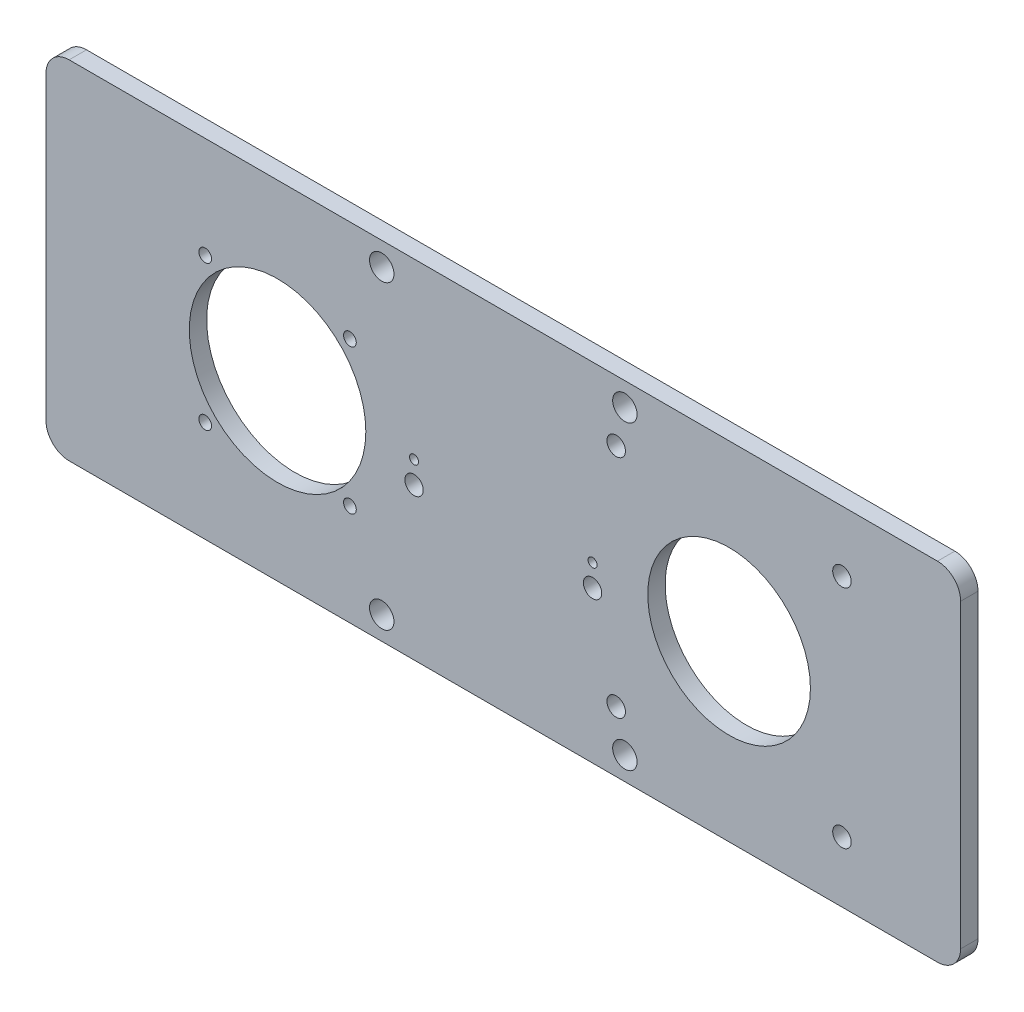
from build123d import *

# Parameters (mm, degrees)
SKETCH3_W             = 158
SKETCH3_H             = 60
SKETCH3_R             = 15.25
SKETCH3_R_2           = 14.05
BOSS_EXTRUDE2_DEPTH   = 3
FILLET1_R             = 4
EVK4_HOLES_D          = 2.2
FLIR_HOLES_D          = 3.2
VN_MOUNT_HOLES_D      = 3.175
VN_REF_HOLES_D        = 1.55
F_1_0MM_DOWEL_HOLE5_D = 4.22


with BuildPart() as part:
    # Sketch3 → Boss-Extrude2 (new body)
    with BuildSketch(Plane.XY):
        with Locations((0, -40)):
            Rectangle(SKETCH3_W, SKETCH3_H)
        with Locations((-39, -40)):
            Circle(SKETCH3_R, mode=Mode.SUBTRACT)
        with Locations((39, -40)):
            Circle(SKETCH3_R_2, mode=Mode.SUBTRACT)
    extrude(amount=-BOSS_EXTRUDE2_DEPTH)

    # Fillet1
    fillet1_edges = [part.edges().sort_by_distance(p)[0] for p in [
        (-79, -70, -1.5),
        (79, -70, -1.5),
        (-79, -10, -1.5),
        (79, -10, -1.5),
    ]]
    fillet(fillet1_edges, radius=FILLET1_R)

    # EVK4-Holes (through all)
    with Locations(Plane.XY):
        with Locations((-51.5, -27.5), (-26.5, -27.5), (-26.5, -52.5), (-51.5, -52.5)):
            Hole(EVK4_HOLES_D / 2)

    # FLIR-Holes (through all)
    with Locations(Plane.XY):
        with Locations((19.5, -20.5), (58.5, -20.5), (58.5, -59.5), (19.5, -59.5)):
            Hole(FLIR_HOLES_D / 2)

    # VN-Mount-Holes (through all)
    with Locations(Plane.XY):
        with Locations((-15.42, -43.81), (15.4159, -43.81)):
            Hole(VN_MOUNT_HOLES_D / 2)

    # VN-Ref-Holes (through all)
    with Locations(Plane.XY):
        with Locations((-15.42, -40), (15.4159, -40)):
            Hole(VN_REF_HOLES_D / 2)

    # Ø1.0mm Dowel Hole5 (through all)
    with Locations(Plane.XY):
        with Locations((-21, -14), (21, -14), (21, -66), (-21, -66)):
            Hole(F_1_0MM_DOWEL_HOLE5_D / 2)


solid = part.part
